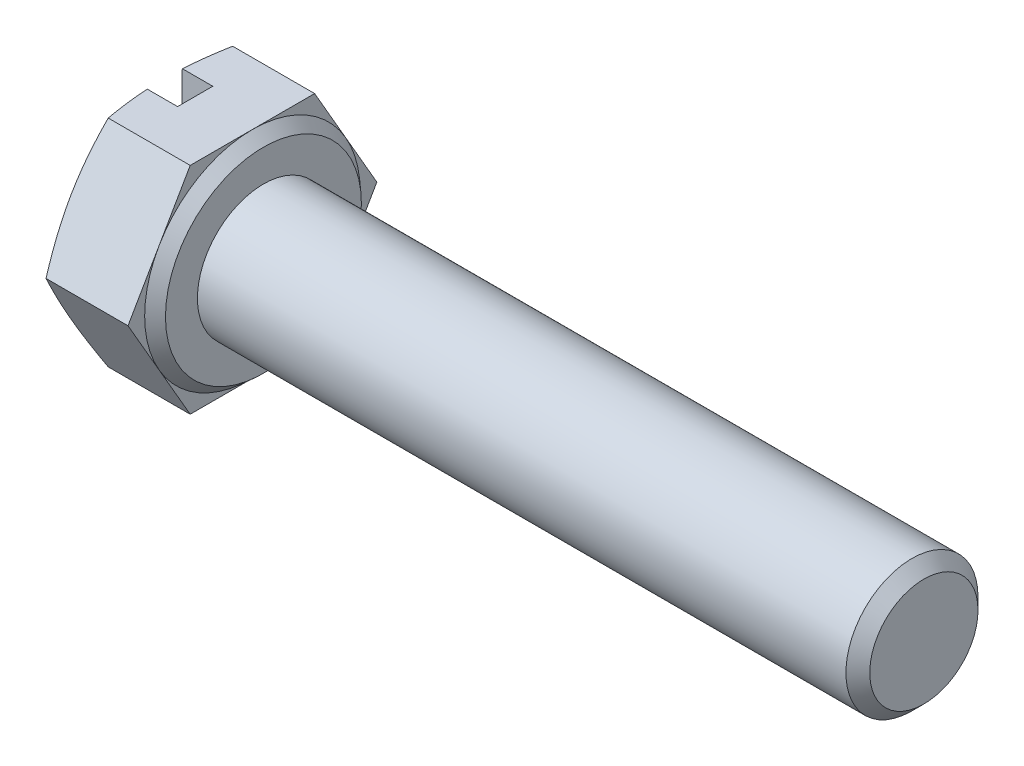
from build123d import *

# Parameters (mm, degrees)
BASEHEAD_DEPTH  = 4
SKETCH3_R       = 3
BASEBODY_DEPTH  = 30
CHAMFER1_SIZE   = 0.5415
SLOT_DEPTH      = 36.30097815
SLOT_DEPTH_BACK = 36.30097815
SKETCH5_W       = 1.4
SKETCH5_H       = 1.6


with BuildPart() as part:
    # Sketch-BaseHead → BaseHead (new body)
    with BuildSketch(Plane(origin=(0, 0, 0), x_dir=(0, 0, -1), z_dir=(1, 0, 0))):
        Polygon((2.826129568, -4.895), (5.652259135, 0), (2.826129568, 4.895), (-2.826129568, 4.895), (-5.652259135, 0), (-2.826129568, -4.895), align=None)
    extrude(amount=BASEHEAD_DEPTH)

    # Sketch1 → Revolve1 (revolve)
    with BuildSketch(Plane.XY):
        Polygon((4, 0), (4.5, 0), (4.5, -4.45), (4, -4.895), align=None)
    revolve(axis=Axis((-4.001564945, 0, 0), (1, 0, 0)))

    # Sketch3 → BaseBody (add)
    with BuildSketch(Plane(origin=(4.5, 0, 0), x_dir=(0, 0, -1), z_dir=(1, 0, 0))):
        Circle(SKETCH3_R)
    extrude(amount=BASEBODY_DEPTH)

    # Chamfer1
    chamfer1_edges = [part.edges().sort_by_distance(p)[0] for p in [
        (34.5, 0, 3),
    ]]
    chamfer(chamfer1_edges, length=CHAMFER1_SIZE)

    # Sketch4 → HeadChamfer (revolve, cut)
    with BuildSketch(Plane(origin=(-0.264637255, 0, 5.916896391), x_dir=(0, 0, -1), z_dir=(0, 1, 0))):
        Polygon((11.569155526, -0.264637255), (10.811896391, -0.264637255), (11.569155526, -0.54025704), align=None)
    revolve(axis=Axis((-4.001564945, 0, 0), (1, 0, 0)), mode=Mode.SUBTRACT)

    # Sketch5 → Slot (cut, two sides: drawn at the far end of the back side and taken through both)
    with BuildSketch(Plane(origin=(0, 0, 0), x_dir=(1, 0, 0), z_dir=(0, 1, 0)).offset(-SLOT_DEPTH_BACK)):
        with Locations((0.7, 0)):
            Rectangle(SKETCH5_W, SKETCH5_H)
    extrude(amount=SLOT_DEPTH + SLOT_DEPTH_BACK, mode=Mode.SUBTRACT)


solid = part.part
